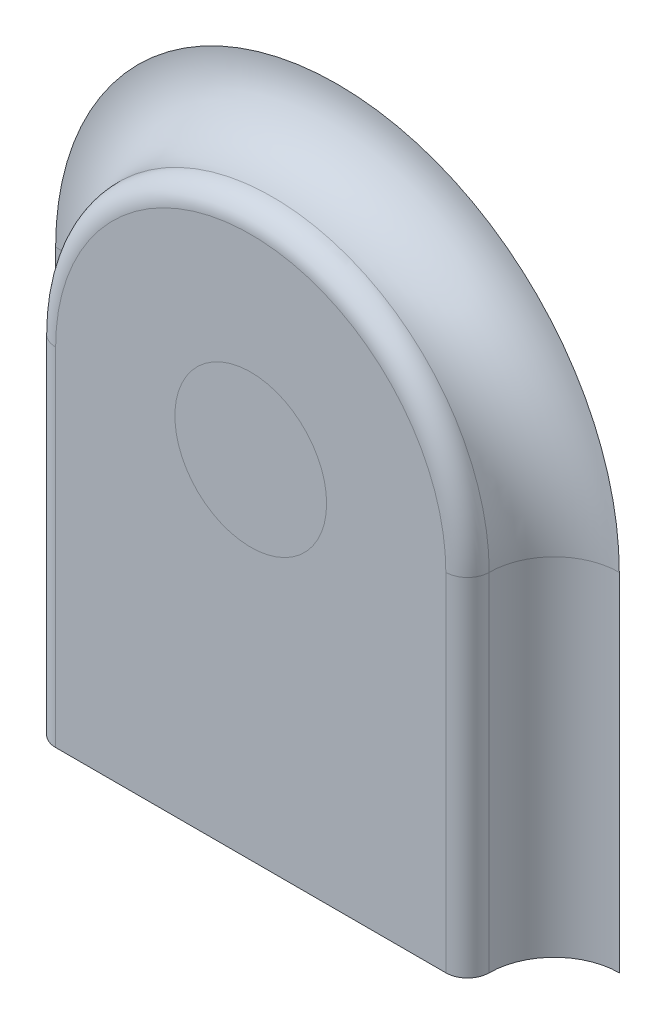
from build123d import *

# Parameters (mm, degrees)
EXTRUDE_1_DEPTH     = 2
SKETCH_2_W          = 17
SKETCH_2_H          = 17
EXTRUDE_2_DEPTH     = 5
FILLET_1_R          = 1.5
FILLET_2_R          = 0.5
SKETCH_3_W          = 5
SKETCH_3_H          = 17
CUT_EXTRUDE_4_DEPTH = 21.346989949


with BuildPart() as part:
    # 草图1 → 凸台-拉伸1 (new body)
    with BuildSketch(Plane.XY):
        with BuildLine():
            Line((-5, 0), (-5, -8))
            Line((-5, -8), (5, -8))
            Line((5, -8), (5, 0))
            ThreePointArc((5, 0), (0, 5), (-5, 0))
        make_face()
    extrude(amount=EXTRUDE_1_DEPTH)

    # 草图2 → 凸台-拉伸2 (add)
    with BuildSketch(Plane(origin=(0, 0, 0), x_dir=(-1, 0, 0), z_dir=(0, 0, -1))):
        with Locations((-1, -1.5)):
            Rectangle(SKETCH_2_W, SKETCH_2_H)
    extrude(amount=EXTRUDE_2_DEPTH)

    # 圆角1
    fillet_1_edges = [part.edges().sort_by_distance(p)[0] for p in [
        (5, -4, 0),
        (-5, -4, 0),
        (0, 5, 0),
    ]]
    fillet(fillet_1_edges, radius=FILLET_1_R)

    # 圆角2
    fillet_2_edges = [part.edges().sort_by_distance(p)[0] for p in [
        (5, -4, 2),
        (-5, -4, 2),
        (0, 5, 2),
    ]]
    fillet(fillet_2_edges, radius=FILLET_2_R - 0.0001)  # a hair under: the kernel refuses the full size

    # 草图3 → 切除-拉伸4 (cut, through all)
    with BuildSketch(Plane.ZY.offset(7.5)):
        with Locations((-2.5, -1.5)):
            Rectangle(SKETCH_3_W, SKETCH_3_H)
    extrude(amount=-CUT_EXTRUDE_4_DEPTH, mode=Mode.SUBTRACT)


solid = part.part
